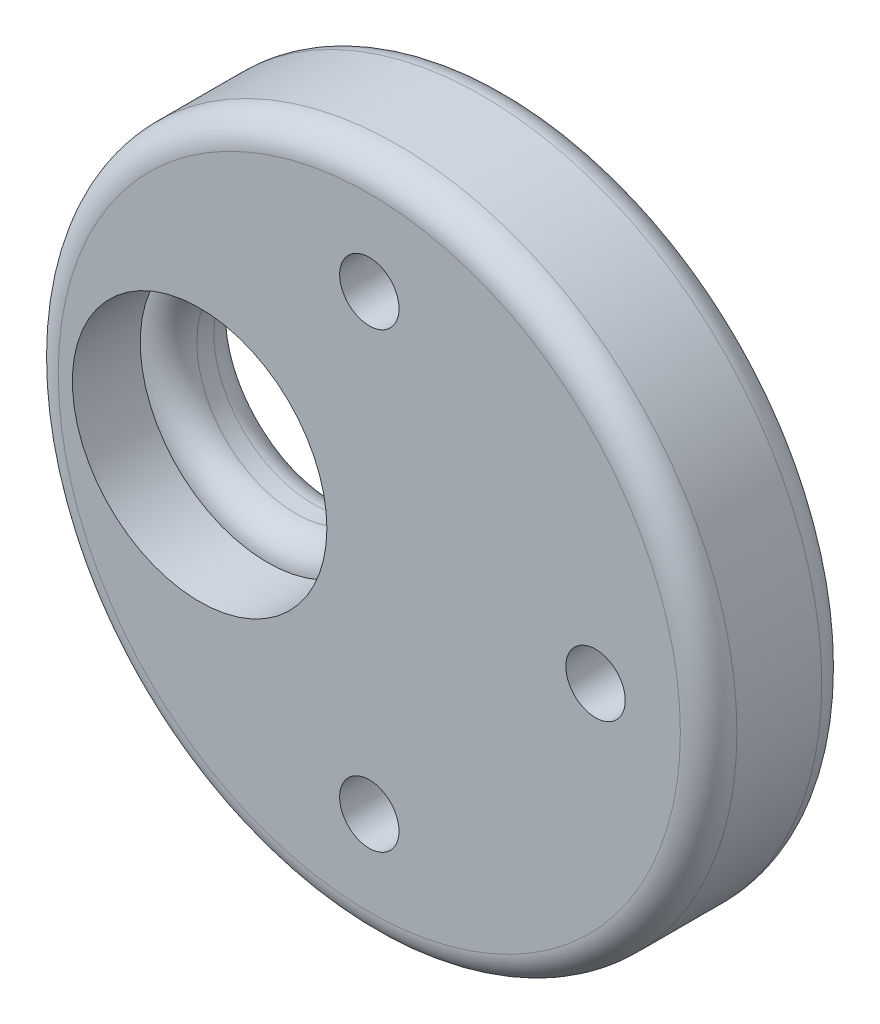
from build123d import *

# Parameters (mm, degrees)
SKETCH1_R           = 12
SKETCH1_R_2         = 1.05
BOSS_EXTRUDE1_DEPTH = 5
HOLE2_D             = 7
HOLE2_DEPTH         = 8
HOLE2_CBORE_D       = 9
HOLE2_CBORE_DEPTH   = 2.4
SKETCH8_R           = 2.15
CUT_EXTRUDE1_DEPTH  = 3
FILLET1_R           = 1
FILLET2_R           = 1


with BuildPart() as part:
    # Sketch1 → Boss-Extrude1 (new body)
    with BuildSketch(Plane.XY):
        Circle(SKETCH1_R)
        with Locations((0, 8)):
            Circle(SKETCH1_R_2, mode=Mode.SUBTRACT)
        with Locations((8, 0)):
            Circle(SKETCH1_R_2, mode=Mode.SUBTRACT)
        with Locations((0, -8)):
            Circle(SKETCH1_R_2, mode=Mode.SUBTRACT)
    extrude(amount=BOSS_EXTRUDE1_DEPTH)

    # Hole2
    with Locations(Plane.XY.offset(5)):
        with Locations((-6, 0)):
            CounterBoreHole(HOLE2_D / 2, HOLE2_CBORE_D / 2, HOLE2_CBORE_DEPTH, depth=HOLE2_DEPTH)

    # Sketch8 → Cut-Extrude1 (cut)
    with BuildSketch(Plane(origin=(0, 0, 0), x_dir=(-1, 0, 0), z_dir=(0, 0, -1))):
        with Locations((0, 8)):
            Circle(SKETCH8_R)
        with Locations((0, -8)):
            Circle(SKETCH8_R)
        with Locations((-8, 0)):
            Circle(SKETCH8_R)
    extrude(amount=-CUT_EXTRUDE1_DEPTH, mode=Mode.SUBTRACT)

    # Fillet1
    fillet1_edges = [part.edges().sort_by_distance(p)[0] for p in [
        (-2.5, 0, 0),
        (-2.5, 0, 2.6),
    ]]
    fillet(fillet1_edges, radius=FILLET1_R - 0.0001)  # a hair under: the kernel refuses the full size

    # Fillet2
    fillet2_edges = [part.edges().sort_by_distance(p)[0] for p in [
        (-12, 0, 0),
        (-12, 0, 5),
    ]]
    fillet(fillet2_edges, radius=FILLET2_R)


solid = part.part
